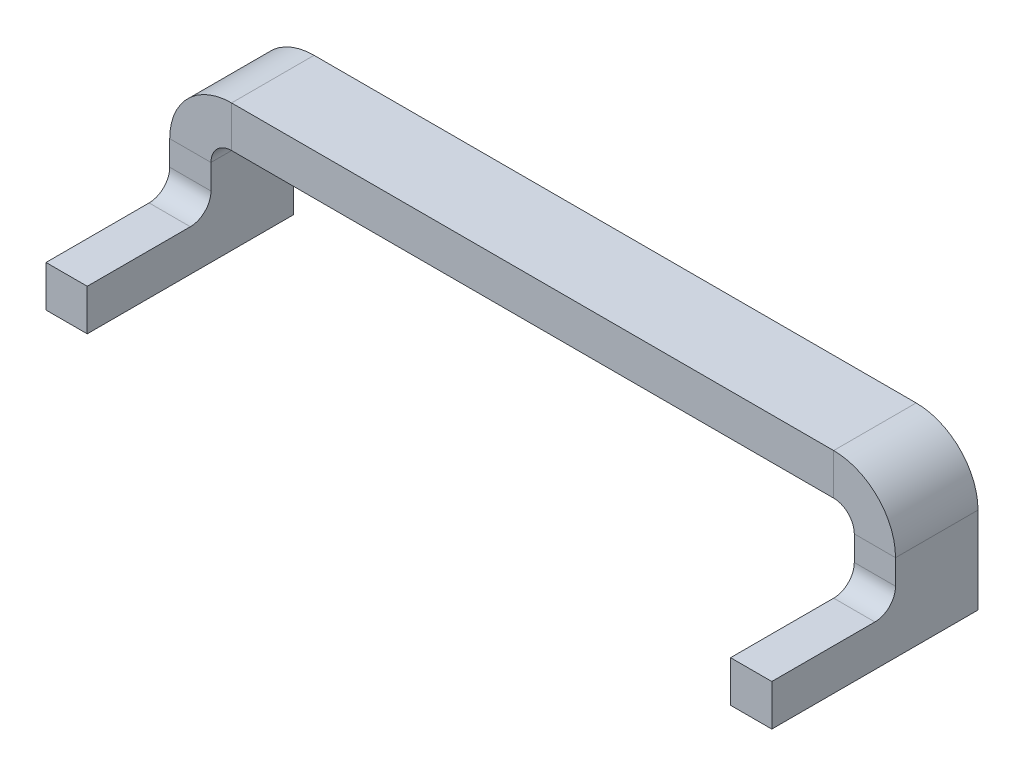
from build123d import *

# Parameters (mm, degrees)
SKETCH2_W                      = 156
SKETCH2_H                      = 20
BASE_FLANGE1_DEPTH             = 10
EDGE_FLANGE1_STRIP_W           = 50
EDGE_FLANGE1_STRIP_H           = 10
EDGE_FLANGE1_STRIP_CUT_DEPTH   = 20
EDGE_FLANGE1_STRIP_2_W         = 50
EDGE_FLANGE1_STRIP_2_H         = 10
EDGE_FLANGE1_STRIP_CUT_2_DEPTH = 20
EDGE_FLANGE1_DEPTH             = 20
EDGE_FLANGE1_BEND_DEPTH        = 20
SKETCH15_W                     = 10
SKETCH15_H                     = 50
BOSS_EXTRUDE1_DEPTH            = 10
FILLET3_R                      = 5


# Sheet-metal steps are written as plain solids
with BuildPart() as part:
    # Sketch2 → Base-Flange1 (new body)
    with BuildSketch(Plane(origin=(0, 0, 0), x_dir=(1, 0, 0), z_dir=(0, 1, 0))):
        with Locations((0, -10)):
            Rectangle(SKETCH2_W, SKETCH2_H)
    extrude(amount=BASE_FLANGE1_DEPTH)

    # Edge-Flange1 strip (across the edge) → Edge-Flange1 strip cut (cut)
    with BuildSketch(Plane(origin=(-78, 0, 20), x_dir=(1, 0, 0), z_dir=(0, 0, -1))):
        with Locations((-20, -5)):
            Rectangle(EDGE_FLANGE1_STRIP_W, EDGE_FLANGE1_STRIP_H)
    extrude(amount=EDGE_FLANGE1_STRIP_CUT_DEPTH, mode=Mode.SUBTRACT)

    # Edge-Flange1 strip 2 (across the edge) → Edge-Flange1 strip cut 2 (cut)
    with BuildSketch(Plane(origin=(78, 0, 0), x_dir=(-1, 0, 0), z_dir=(0, 0, 1))):
        with Locations((-20, -5)):
            Rectangle(EDGE_FLANGE1_STRIP_2_W, EDGE_FLANGE1_STRIP_2_H)
    extrude(amount=EDGE_FLANGE1_STRIP_CUT_2_DEPTH, mode=Mode.SUBTRACT)

    # Edge-Flange1 section (across the edge) → Edge-Flange1 (add)
    with BuildSketch(Plane(origin=(-78, 0, 20), x_dir=(1, 0, 0), z_dir=(0, 0, -1))):
        with BuildLine():
            Line((-10, 5), (-10, 26))
            Line((-10, 26), (0, 26))
            Line((0, 26), (0, 5))
            ThreePointArc((0, 5), (1.464466094, 1.464466094), (5, 0))
            Line((5, 0), (5, -10))
            ThreePointArc((5, -10), (-5.606601718, -5.606601718), (-10, 5))
        make_face()
    extrude(amount=EDGE_FLANGE1_DEPTH)

    # Edge-Flange1 section 2 (across the edge) → Edge-Flange1 bend (add)
    with BuildSketch(Plane(origin=(78, 0, 0), x_dir=(-1, 0, 0), z_dir=(0, 0, 1))):
        with BuildLine():
            Line((-10, 5), (-10, 26))
            Line((-10, 26), (0, 26))
            Line((0, 26), (0, 5))
            ThreePointArc((0, 5), (1.464466094, 1.464466094), (5, 0))
            Line((5, 0), (5, -10))
            ThreePointArc((5, -10), (-5.606601718, -5.606601718), (-10, 5))
        make_face()
    extrude(amount=EDGE_FLANGE1_BEND_DEPTH)

    # Sketch15 → Boss-Extrude1 (add)
    with BuildSketch(Plane.XZ.offset(26)):
        with Locations((-83, 25)):
            Rectangle(SKETCH15_W, SKETCH15_H)
        with Locations((83, 25)):
            Rectangle(SKETCH15_W, SKETCH15_H)
    extrude(amount=-BOSS_EXTRUDE1_DEPTH)

    # Fillet3
    fillet3_edges = [part.edges().sort_by_distance(p)[0] for p in [
        (83, -16, 20),
        (-83, -16, 20),
    ]]
    fillet(fillet3_edges, radius=FILLET3_R)


solid = part.part
